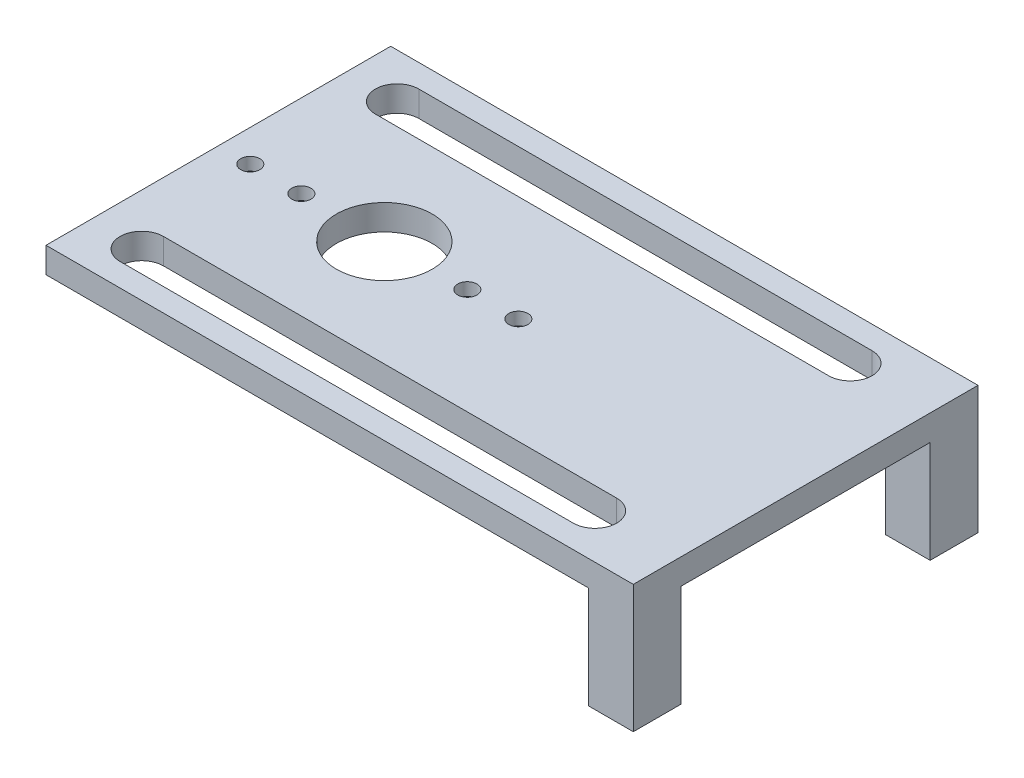
from build123d import *

# Parameters (mm, degrees)
SKETCH1_W                  = 46
SKETCH1_H                  = 27
SKETCH1_R                  = 3.75
BOSS_EXTRUDE1_DEPTH        = 2
SKETCH7_W                  = 3.5
SKETCH7_H                  = 27
BOSS_EXTRUDE4_DEPTH        = 8
CUT_EXTRUDE3_REACH         = 47.305
SKETCH8_W                  = 19.5
SKETCH8_H                  = 8
CUT_EXTRUDE4_REACH         = 38.541
CUT_EXTRUDE5_REACH         = 39.03
SKETCH10_R                 = 0.75
CHAMFER1_SIZE              = 1
LPATTERN1_COUNT            = 2
LPATTERN1_PITCH            = 4
CHAMFER1_OF_LPATTERN1_SIZE = 1


# Read off the part's stored shape, not the designer's step: Mirror2
with BuildPart() as part:
    # Sketch1 → Boss-Extrude1 (new body)
    with BuildSketch(Plane(origin=(0, 0, 0), x_dir=(1, 0, 0), z_dir=(0, 1, 0))):
        with Locations((10, 0)):
            Rectangle(SKETCH1_W, SKETCH1_H)
        with Locations(Location((0, 0, 0), (0, 0, 270))):
            Circle(SKETCH1_R, mode=Mode.SUBTRACT)
    extrude(amount=BOSS_EXTRUDE1_DEPTH)

    # Sketch7 → Boss-Extrude4 (add)
    with BuildSketch(Plane.XZ):
        with Locations((31.25, 0)):
            Rectangle(SKETCH7_W, SKETCH7_H)
    extrude(amount=BOSS_EXTRUDE4_DEPTH)

    # Sketch8 → Cut-Extrude3 (cut, up to next)
    with BuildSketch(Plane.ZY.offset(-29.5), mode=Mode.PRIVATE) as cut_extrude3_sk1:
        with Locations((0, -4)):
            Rectangle(SKETCH8_W, SKETCH8_H)
    cut_extrude3_tool1 = extrude(cut_extrude3_sk1.sketch, amount=-CUT_EXTRUDE3_REACH, mode=Mode.PRIVATE) & part.part
    add(cut_extrude3_tool1.solids().sort_by_distance((29.5, -4, 0))[0], mode=Mode.SUBTRACT)

    # Sketch9 → Cut-Extrude4 (cut, up to next)
    with BuildSketch(Plane.XZ, mode=Mode.PRIVATE) as cut_extrude4_sk1:
        with BuildLine():
            Line((-9, 11.7), (26.5, 11.7))
            ThreePointArc((26.5, 11.7), (28.2, 10), (26.5, 8.3))
            Line((26.5, 8.3), (-9, 8.3))
            ThreePointArc((-9, 8.3), (-10.7, 10), (-9, 11.7))
        make_face()
    cut_extrude4_tool1 = extrude(cut_extrude4_sk1.sketch, amount=-CUT_EXTRUDE4_REACH, mode=Mode.PRIVATE) & part.part
    cut_extrude4 = cut_extrude4_tool1.solids().sort_by_distance((8.75, 0, 10))[0]
    add(cut_extrude4, mode=Mode.SUBTRACT)

    # Mirror1: Cut-Extrude4 across plane
    add(cut_extrude4.mirror(Plane.XY), mode=Mode.SUBTRACT)

    # Sketch10 → Cut-Extrude5 (cut, up to next)
    with BuildSketch(Plane(origin=(0, 2, 0), x_dir=(1, 0, 0), z_dir=(0, 1, 0)), mode=Mode.PRIVATE) as cut_extrude5_sk1:
        with Locations(Location((-6.5, 0, 0), (0, 0, 270))):
            Circle(SKETCH10_R)
    cut_extrude5_tool1 = extrude(cut_extrude5_sk1.sketch, amount=-CUT_EXTRUDE5_REACH, mode=Mode.PRIVATE) & part.part
    cut_extrude5 = cut_extrude5_tool1.solids().sort_by_distance((-6.5, 2, 0))[0]
    add(cut_extrude5, mode=Mode.SUBTRACT)

    # Chamfer1
    chamfer1_edges = [part.edges().sort_by_distance(p)[0] for p in [
        (-6.5, 0, -0.75),
    ]]
    chamfer(chamfer1_edges, length=CHAMFER1_SIZE)

    # LPattern1: Cut-Extrude5 ×2
    with Locations(*[(-i * LPATTERN1_PITCH, 0, 0) for i in range(1, LPATTERN1_COUNT)]):
        add(cut_extrude5, mode=Mode.SUBTRACT)

    # Chamfer1 of LPattern1
    chamfer1_of_lpattern1_edges = [part.edges().sort_by_distance(p)[0] for p in [
        (-10.5, 0, -0.75),
    ]]
    chamfer(chamfer1_of_lpattern1_edges, length=CHAMFER1_OF_LPATTERN1_SIZE)

    # Mirror2 outline → Mirror2 (revolve, cut)
    with BuildSketch(Plane(origin=(6.5, 0, 0), x_dir=(1, 0, 0), z_dir=(0, 0, 1))):
        Polygon((0, 0), (1.75, 0), (0.75, 1), (0.75, 2), (0, 2), align=None)
    revolve(axis=Axis((6.5, 0, 0), (0, 1, 0)), mode=Mode.SUBTRACT)

    # Mirror2 2 outline → Mirror2 2 (revolve, cut)
    with BuildSketch(Plane(origin=(10.5, 0, 0), x_dir=(1, 0, 0), z_dir=(0, 0, 1))):
        Polygon((0, 0), (1.75, 0), (0.75, 1), (0.75, 2), (0, 2), align=None)
    revolve(axis=Axis((10.5, 0, 0), (0, 1, 0)), mode=Mode.SUBTRACT)


solid = part.part
